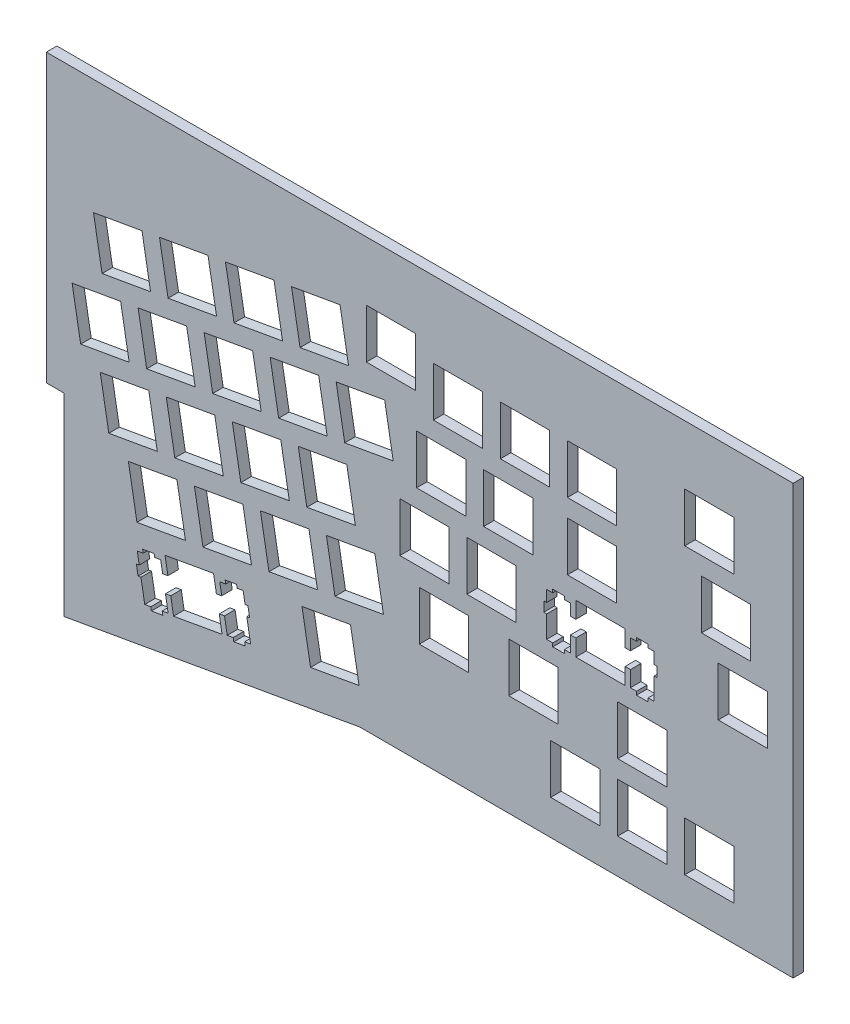
from build123d import *

# Parameters (mm, degrees)
RESSALTO_EXTRUS_O1_OUTLINE_W    = 385.763002014
RESSALTO_EXTRUS_O1_OUTLINE_H    = 172.784175795
RESSALTO_EXTRUS_O1_OUTLINE_W_2  = 13.999553143
RESSALTO_EXTRUS_O1_OUTLINE_H_2  = 14.000893144
RESSALTO_EXTRUS_O1_OUTLINE_W_3  = 13.999543143
RESSALTO_EXTRUS_O1_OUTLINE_H_3  = 14.000703143
RESSALTO_EXTRUS_O1_OUTLINE_W_4  = 13.998003143
RESSALTO_EXTRUS_O1_OUTLINE_W_5  = 14.000003143
RESSALTO_EXTRUS_O1_OUTLINE_W_6  = 14.000003144
RESSALTO_EXTRUS_O1_OUTLINE_W_7  = 13.999503143
RESSALTO_EXTRUS_O1_OUTLINE_H_4  = 13.999303143
RESSALTO_EXTRUS_O1_OUTLINE_H_5  = 13.999103143
RESSALTO_EXTRUS_O1_OUTLINE_W_8  = 13.999303144
RESSALTO_EXTRUS_O1_OUTLINE_W_9  = 13.999303143
RESSALTO_EXTRUS_O1_OUTLINE_W_10 = 13.999403143
RESSALTO_EXTRUS_O1_OUTLINE_H_6  = 13.999003143
RESSALTO_EXTRUS_O1_OUTLINE_H_7  = 14.000003143
RESSALTO_EXTRUS_O1_OUTLINE_W_11 = 14.001003144
RESSALTO_EXTRUS_O1_OUTLINE_W_12 = 13.999003143
RESSALTO_EXTRUS_O1_OUTLINE_H_8  = 14.000003144
RESSALTO_EXTRUS_O1_OUTLINE_W_13 = 13.999003144
RESSALTO_EXTRUS_O1_DEPTH        = 3
CORTE_EXTRUS_O1_DEPTH           = 3
CORTE_EXTRUS_O2_DEPTH           = 3


# Read off the part's stored shape, not the designer's step: Ressalto-extrusão1
with BuildPart() as part:
    # Ressalto-extrusão1 outline → Ressalto-extrusão1 (new body)
    with BuildSketch(Plane.XY):
        with Locations((-32.928151592, -125.295959232)):
            Rectangle(RESSALTO_EXTRUS_O1_OUTLINE_W, RESSALTO_EXTRUS_O1_OUTLINE_H)
        with Locations((-216.285310061, -202.161652991)):
            Rectangle(RESSALTO_EXTRUS_O1_OUTLINE_W_2, RESSALTO_EXTRUS_O1_OUTLINE_H_2, mode=Mode.SUBTRACT)
        with Locations((-211.522803992, -143.677644859)):
            Rectangle(RESSALTO_EXTRUS_O1_OUTLINE_W_3, RESSALTO_EXTRUS_O1_OUTLINE_H_3, mode=Mode.SUBTRACT)
        Polygon((-142.042718391, -152.663796877), (-155.830021487, -150.233196332), (-153.399320941, -136.447293236), (-139.610717845, -138.877993782), align=None, mode=Mode.SUBTRACT)
        Polygon((-124.664714489, -136.385193222), (-138.451817585, -133.954192677), (-136.020817039, -120.166989581), (-122.233713943, -122.597990127), align=None, mode=Mode.SUBTRACT)
        Polygon((-128.757115408, -141.024994264), (-127.058115027, -141.324094331), (-126.888414988, -140.359294115), (-123.637714259, -140.932494243), (-123.808714297, -141.89739446), (-122.109713916, -142.197594527), (-122.88671409, -146.599195516), (-121.384713753, -146.865195575), (-120.56871357, -142.234994536), (-106.779710474, -144.666995082), (-107.595710657, -149.295796121), (-106.09571032, -149.560396181), (-105.317710145, -145.157795192), (-103.620709764, -145.457995259), (-103.449709726, -144.492095043), (-100.199708996, -145.065295171), (-100.369709034, -146.030195388), (-98.671708653, -146.330395455), (-99.760708898, -152.503996841), (-98.947708715, -152.648596874), (-99.433708824, -155.404897493), (-100.245709006, -155.262697461), (-100.807709133, -158.443398175), (-102.506709514, -158.143198108), (-102.66570955, -159.049798311), (-105.914710279, -158.476498182), (-105.756710244, -157.570897979), (-107.453710625, -157.272097912), (-106.893710499, -154.090097198), (-108.394710836, -153.825497138), (-109.210711019, -158.452898177), (-122.999714115, -156.022197631), (-122.182713932, -151.394896592), (-123.684714269, -151.130296533), (-124.245714395, -154.310597247), (-125.944414777, -154.01039718), (-126.104614812, -154.916997383), (-129.353715542, -154.343697255), (-129.193815506, -153.437097051), (-130.893215888, -153.137896984), (-130.332315762, -149.95729627), (-131.144015944, -149.814096237), (-130.658915835, -147.056795618), (-129.845815652, -147.199995651), align=None, mode=Mode.SUBTRACT)
        Polygon((-81.071704701, -163.415399291), (-94.858707797, -160.984398746), (-92.426707251, -147.19719565), (-78.639704155, -149.628196196), align=None, mode=Mode.SUBTRACT)
        Polygon((-25.135692142, -144.336495008), (-25.293692178, -143.430894804), (-22.044691448, -142.857594676), (-21.884691412, -143.763194879), (-20.185691031, -143.464094812), (-19.624690905, -146.644695526), (-18.813690723, -146.501495494), (-18.326690613, -149.258796113), (-19.139690796, -149.401996145), (-18.049690551, -155.576997531), (-19.748690933, -155.876197599), (-19.579690895, -156.842097815), (-22.828691624, -157.413997944), (-22.999691663, -156.449497727), (-24.698692044, -156.748297794), (-25.474692218, -152.346996806), (-26.976692556, -152.611596866), (-26.160692372, -157.240397905), (-39.946695468, -159.671398451), (-40.763695651, -155.042197411), (-42.264695988, -155.306797471), (-41.488695814, -159.709798459), (-43.187696195, -160.008998527), (-43.016696157, -160.974898743), (-46.267696887, -161.548198872), (-46.436696925, -160.582298655), (-48.136697307, -160.881098722), (-49.224697551, -154.707397336), (-50.036697733, -154.850697368), (-50.524697843, -152.091996749), (-49.71169766, -151.950096717), (-50.272697786, -148.768096003), (-48.572697404, -148.469295936), (-48.73269744, -147.563695732), (-45.483696711, -146.990395603), (-45.323696675, -147.895995807), (-43.624696294, -147.59689574), (-43.063696168, -150.777496454), (-41.56169583, -150.512896394), (-42.377696014, -145.884095355), (-28.591692918, -143.453094809), (-27.775692735, -148.081895849), (-26.273692398, -147.815895789), (-26.834692524, -144.635295075), align=None, mode=Mode.SUBTRACT)
        Polygon((-105.903710277, -139.693893965), (-119.690713372, -137.262893419), (-117.259712827, -123.474290324), (-103.472709731, -125.90669087), align=None, mode=Mode.SUBTRACT)
        Polygon((-87.142706064, -143.001194708), (-100.93070916, -140.570194162), (-98.499708614, -126.782991066), (-84.712705519, -129.213991612), align=None, mode=Mode.SUBTRACT)
        Polygon((-50.356697805, -141.775994433), (-52.786698351, -127.988791337), (-38.999695255, -125.557790791), (-36.569694709, -139.344993887), align=None, mode=Mode.SUBTRACT)
        with Locations((150.428347277, -202.161652991)):
            Rectangle(RESSALTO_EXTRUS_O1_OUTLINE_W_4, RESSALTO_EXTRUS_O1_OUTLINE_H_2, mode=Mode.SUBTRACT)
        Polygon((-1.019686728, -152.80739691), (-3.450687273, -139.019793814), (10.338315823, -136.589093268), (12.769316368, -150.376396364), align=None, mode=Mode.SUBTRACT)
        Polygon((-31.595693593, -138.46869369), (-34.026694139, -124.680090594), (-20.239691043, -122.249090048), (-17.808690497, -136.036293144), align=None, mode=Mode.SUBTRACT)
        Polygon((-12.83468938, -135.159992947), (-15.265689926, -121.372789852), (-1.478686831, -118.941789306), (0.952313715, -132.727992401), align=None, mode=Mode.SUBTRACT)
        with Locations((74.227330168, -143.677644859)):
            Rectangle(RESSALTO_EXTRUS_O1_OUTLINE_W_5, RESSALTO_EXTRUS_O1_OUTLINE_H_3, mode=Mode.SUBTRACT)
        with Locations((93.277334445, -143.677644859)):
            Rectangle(RESSALTO_EXTRUS_O1_OUTLINE_W_5, RESSALTO_EXTRUS_O1_OUTLINE_H_3, mode=Mode.SUBTRACT)
        with Locations((112.327338722, -143.677644859)):
            Rectangle(RESSALTO_EXTRUS_O1_OUTLINE_W_6, RESSALTO_EXTRUS_O1_OUTLINE_H_3, mode=Mode.SUBTRACT)
        with Locations((-204.570682431, -124.628340583)):
            Rectangle(RESSALTO_EXTRUS_O1_OUTLINE_W_7, RESSALTO_EXTRUS_O1_OUTLINE_H_4, mode=Mode.SUBTRACT)
        with Locations((-204.379082388, -105.578436306)):
            Rectangle(RESSALTO_EXTRUS_O1_OUTLINE_W_7, RESSALTO_EXTRUS_O1_OUTLINE_H_5, mode=Mode.SUBTRACT)
        with Locations((-178.185376506, -105.578436306)):
            Rectangle(RESSALTO_EXTRUS_O1_OUTLINE_W_8, RESSALTO_EXTRUS_O1_OUTLINE_H_5, mode=Mode.SUBTRACT)
        with Locations((-173.422875437, -124.628340583)):
            Rectangle(RESSALTO_EXTRUS_O1_OUTLINE_W_9, RESSALTO_EXTRUS_O1_OUTLINE_H_4, mode=Mode.SUBTRACT)
        Polygon((-143.424918701, -133.07789248), (-157.212221797, -130.646891934), (-154.781521251, -116.859688838), (-140.994318156, -119.290689384), align=None, mode=Mode.SUBTRACT)
        Polygon((-149.496620065, -112.662287896), (-163.28382316, -110.23088735), (-160.853222614, -96.443884254), (-147.065919519, -98.8748848), align=None, mode=Mode.SUBTRACT)
        Polygon((-130.735815852, -115.970988639), (-144.524518948, -113.539988093), (-142.093918403, -99.752884997), (-128.305215307, -102.183885543), align=None, mode=Mode.SUBTRACT)
        with Locations((-201.997831853, -86.528382029)):
            Rectangle(RESSALTO_EXTRUS_O1_OUTLINE_W_10, RESSALTO_EXTRUS_O1_OUTLINE_H_6, mode=Mode.SUBTRACT)
        with Locations((-178.185376506, -86.528382029)):
            Rectangle(RESSALTO_EXTRUS_O1_OUTLINE_W_8, RESSALTO_EXTRUS_O1_OUTLINE_H_6, mode=Mode.SUBTRACT)
        Polygon((-150.878720375, -93.075883498), (-164.666023471, -90.643882952), (-162.235422925, -76.856879857), (-148.447819829, -79.287880402), align=None, mode=Mode.SUBTRACT)
        Polygon((-132.118016163, -96.383884241), (-145.906719259, -93.952883695), (-143.474618713, -80.163880599), (-129.687415617, -82.595881145), align=None, mode=Mode.SUBTRACT)
        Polygon((-111.97671164, -119.278289381), (-125.762714736, -116.847288836), (-123.33171419, -103.05988574), (-109.544711094, -105.490886286), align=None, mode=Mode.SUBTRACT)
        Polygon((-93.214707428, -122.586690124), (-107.001710523, -120.155989578), (-104.570709978, -106.368886483), (-90.783706882, -108.799887029), align=None, mode=Mode.SUBTRACT)
        Polygon((-58.354699601, -123.842190406), (-60.785700147, -110.05488731), (-46.997697051, -107.623886765), (-44.567696505, -121.41118986), align=None, mode=Mode.SUBTRACT)
        Polygon((-39.593695388, -120.534889664), (-42.024695934, -106.747886568), (-28.237692839, -104.316886022), (-25.806692293, -118.103889118), align=None, mode=Mode.SUBTRACT)
        Polygon((-94.596707738, -102.998885726), (-108.385710834, -100.568885181), (-105.953710288, -86.779882085), (-92.165707192, -89.211882631), align=None, mode=Mode.SUBTRACT)
        Polygon((-113.35771195, -99.691884984), (-127.144915046, -97.259884438), (-124.7137145, -83.472881342), (-110.926711405, -85.903881888), align=None, mode=Mode.SUBTRACT)
        Polygon((-66.352701397, -105.90888638), (-68.783701942, -92.120883284), (-54.996698847, -89.689882738), (-52.565698301, -103.477885834), align=None, mode=Mode.SUBTRACT)
        Polygon((-47.591697184, -102.600885637), (-50.02269773, -88.813882541), (-36.235694634, -86.382881995), (-33.804694089, -100.168885091), align=None, mode=Mode.SUBTRACT)
        with Locations((-201.997831853, -67.478377751)):
            Rectangle(RESSALTO_EXTRUS_O1_OUTLINE_W_10, RESSALTO_EXTRUS_O1_OUTLINE_H_6, mode=Mode.SUBTRACT)
        with Locations((-182.947877576, -67.478377751)):
            Rectangle(RESSALTO_EXTRUS_O1_OUTLINE_W_9, RESSALTO_EXTRUS_O1_OUTLINE_H_6, mode=Mode.SUBTRACT)
        with Locations((-163.897873298, -62.715876682)):
            Rectangle(RESSALTO_EXTRUS_O1_OUTLINE_W_8, RESSALTO_EXTRUS_O1_OUTLINE_H_7, mode=Mode.SUBTRACT)
        Polygon((-138.191117526, -75.968879657), (-151.978420622, -73.536879111), (-149.547720076, -59.750876016), (-135.76051698, -62.181876562), align=None, mode=Mode.SUBTRACT)
        Polygon((-100.671709102, -82.584881143), (-114.457712197, -80.152880597), (-112.026711652, -66.366877501), (-98.237708556, -68.797878047), align=None, mode=Mode.SUBTRACT)
        Polygon((-81.90970489, -85.892881885), (-95.696707985, -83.46188134), (-93.265707439, -69.673878244), (-79.478704344, -72.10487879), align=None, mode=Mode.SUBTRACT)
        Polygon((-119.430713314, -79.2768804), (-133.21801641, -76.845879854), (-130.785615864, -63.057876758), (-116.999712768, -65.488877304), align=None, mode=Mode.SUBTRACT)
        Polygon((-60.279700033, -85.493881796), (-62.710700579, -71.7068787), (-48.924697484, -69.275878154), (-46.493696938, -83.06288125), align=None, mode=Mode.SUBTRACT)
        Polygon((-41.520695821, -82.186881053), (-43.951696367, -68.397877957), (-30.162693271, -65.966877412), (-27.731692725, -79.755880508), align=None, mode=Mode.SUBTRACT)
        Polygon((5.925314832, -131.852692205), (3.493314286, -118.064089109), (17.282317382, -115.633388563), (19.712317927, -129.420691659), align=None, mode=Mode.SUBTRACT)
        Polygon((-20.833691176, -117.226188921), (-23.264691722, -103.438885825), (-9.476688626, -101.007885279), (-7.045688081, -114.795588375), align=None, mode=Mode.SUBTRACT)
        Polygon((-2.072686964, -113.918888178), (-4.50368751, -100.131885083), (9.283315586, -97.700884537), (11.714316132, -111.487887632), align=None, mode=Mode.SUBTRACT)
        with Locations((36.888821784, -124.628340583)):
            Rectangle(RESSALTO_EXTRUS_O1_OUTLINE_W_11, RESSALTO_EXTRUS_O1_OUTLINE_H_4, mode=Mode.SUBTRACT)
        with Locations((62.320827495, -124.628340583)):
            Rectangle(RESSALTO_EXTRUS_O1_OUTLINE_W_12, RESSALTO_EXTRUS_O1_OUTLINE_H_4, mode=Mode.SUBTRACT)
        with Locations((31.364820544, -105.578436306)):
            Rectangle(RESSALTO_EXTRUS_O1_OUTLINE_W_12, RESSALTO_EXTRUS_O1_OUTLINE_H_5, mode=Mode.SUBTRACT)
        with Locations((50.414824821, -105.578436306)):
            Rectangle(RESSALTO_EXTRUS_O1_OUTLINE_W_12, RESSALTO_EXTRUS_O1_OUTLINE_H_5, mode=Mode.SUBTRACT)
        Polygon((-28.831692972, -99.290884894), (-31.262693518, -85.504881798), (-17.474690422, -83.074881253), (-15.043689876, -96.861884348), align=None, mode=Mode.SUBTRACT)
        Polygon((-10.07068876, -95.983884151), (-12.501689306, -82.197881056), (1.28431379, -79.76688051), (3.716314336, -93.552883605), align=None, mode=Mode.SUBTRACT)
        Polygon((8.689315452, -92.676883409), (6.259314907, -78.888880313), (20.046318002, -76.458879767), (22.477318548, -90.245882863), align=None, mode=Mode.SUBTRACT)
        with Locations((36.127321613, -86.528382029)):
            Rectangle(RESSALTO_EXTRUS_O1_OUTLINE_W_6, RESSALTO_EXTRUS_O1_OUTLINE_H_6, mode=Mode.SUBTRACT)
        with Locations((55.17732589, -86.528382029)):
            Rectangle(RESSALTO_EXTRUS_O1_OUTLINE_W_6, RESSALTO_EXTRUS_O1_OUTLINE_H_6, mode=Mode.SUBTRACT)
        with Locations((93.277334445, -124.628340583)):
            Rectangle(RESSALTO_EXTRUS_O1_OUTLINE_W_5, RESSALTO_EXTRUS_O1_OUTLINE_H_4, mode=Mode.SUBTRACT)
        Polygon((74.3713302, -103.278885789), (74.3713302, -98.578884734), (88.370333343, -98.578884734), (88.370333343, -103.278885789), (89.896333686, -103.278885789), (89.896333686, -100.048885064), (91.621334073, -100.048885064), (91.621334073, -99.126884857), (94.920334814, -99.126884857), (94.920334814, -100.048885064), (96.645335201, -100.048885064), (96.645335201, -103.278885789), (97.471335386, -103.278885789), (97.471335386, -106.077886418), (96.645335201, -106.077886418), (96.645335201, -112.347987825), (94.920334814, -112.347987825), (94.920334814, -113.329088046), (91.621334073, -113.329088046), (91.621334073, -112.347987825), (89.896333686, -112.347987825), (89.896333686, -107.878886822), (88.370333343, -107.878886822), (88.370333343, -112.577987877), (74.3713302, -112.577987877), (74.3713302, -107.878886822), (72.846329857, -107.878886822), (72.846329857, -112.347987825), (71.12032947, -112.347987825), (71.12032947, -113.329088046), (67.821328729, -113.329088046), (67.821328729, -112.347987825), (66.096328342, -112.347987825), (66.096328342, -106.077886418), (65.270328156, -106.077886418), (65.270328156, -103.278885789), (66.096328342, -103.278885789), (66.096328342, -100.048885064), (67.821328729, -100.048885064), (67.821328729, -99.126884857), (71.12032947, -99.126884857), (71.12032947, -100.048885064), (72.846329857, -100.048885064), (72.846329857, -103.278885789), align=None, mode=Mode.SUBTRACT)
        with Locations((78.989831237, -86.528382029)):
            Rectangle(RESSALTO_EXTRUS_O1_OUTLINE_W_12, RESSALTO_EXTRUS_O1_OUTLINE_H_6, mode=Mode.SUBTRACT)
        with Locations((121.852340861, -100.815885236)):
            Rectangle(RESSALTO_EXTRUS_O1_OUTLINE_W_5, RESSALTO_EXTRUS_O1_OUTLINE_H_8, mode=Mode.SUBTRACT)
        Polygon((-22.759691609, -78.87788031), (-25.190692155, -65.090877215), (-11.403689059, -62.659876669), (-8.972688513, -76.446879765), align=None, mode=Mode.SUBTRACT)
        Polygon((-3.997687396, -75.570879568), (-6.429687942, -61.781876472), (7.357315153, -59.350875926), (9.789315699, -73.139879022), align=None, mode=Mode.SUBTRACT)
        with Locations((21.839818405, -62.715876682)):
            Rectangle(RESSALTO_EXTRUS_O1_OUTLINE_W_13, RESSALTO_EXTRUS_O1_OUTLINE_H_7, mode=Mode.SUBTRACT)
        with Locations((40.889822682, -67.478377751)):
            Rectangle(RESSALTO_EXTRUS_O1_OUTLINE_W_12, RESSALTO_EXTRUS_O1_OUTLINE_H_6, mode=Mode.SUBTRACT)
        with Locations((59.93982696, -67.478377751)):
            Rectangle(RESSALTO_EXTRUS_O1_OUTLINE_W_12, RESSALTO_EXTRUS_O1_OUTLINE_H_6, mode=Mode.SUBTRACT)
        with Locations((78.989831237, -67.478377751)):
            Rectangle(RESSALTO_EXTRUS_O1_OUTLINE_W_12, RESSALTO_EXTRUS_O1_OUTLINE_H_6, mode=Mode.SUBTRACT)
        with Locations((117.089839791, -81.765880959)):
            Rectangle(RESSALTO_EXTRUS_O1_OUTLINE_W_12, RESSALTO_EXTRUS_O1_OUTLINE_H_8, mode=Mode.SUBTRACT)
        with Locations((112.327338722, -62.715876682)):
            Rectangle(RESSALTO_EXTRUS_O1_OUTLINE_W_6, RESSALTO_EXTRUS_O1_OUTLINE_H_7, mode=Mode.SUBTRACT)
    extrude(amount=RESSALTO_EXTRUS_O1_DEPTH)

    # Esboço2 → Corte-extrusão1 (cut)
    with BuildSketch(Plane.XY.offset(3)):
        Polygon((-225.809652599, -160.677996431), (-225.809652599, -211.68804713), (159.953349415, -211.68804713), (159.953349415, -38.903871335), (136.142342432, -38.903871335), (136.142342432, -160.677996431), (13.03442747, -160.483082346), (-71.116906176, -175.322186661), (-153.587996554, -160.784331894), (-156.132242037, -160.677996431), align=None)
    extrude(amount=-CORTE_EXTRUS_O1_DEPTH, mode=Mode.SUBTRACT)

    # Esboço3 → Corte-extrusão2 (cut)
    with BuildSketch(Plane.XY.offset(3)):
        Polygon((-71.116906176, -175.322186661), (-71.116906176, -120.322186661), (-76.116906176, -120.322186661), (-76.116906176, -38.903871335), (-225.809652599, -38.903871335), (-225.809652599, -160.677996431), (-153.587996554, -160.784331894), align=None)
    extrude(amount=-CORTE_EXTRUS_O2_DEPTH, mode=Mode.SUBTRACT)


solid = part.part
